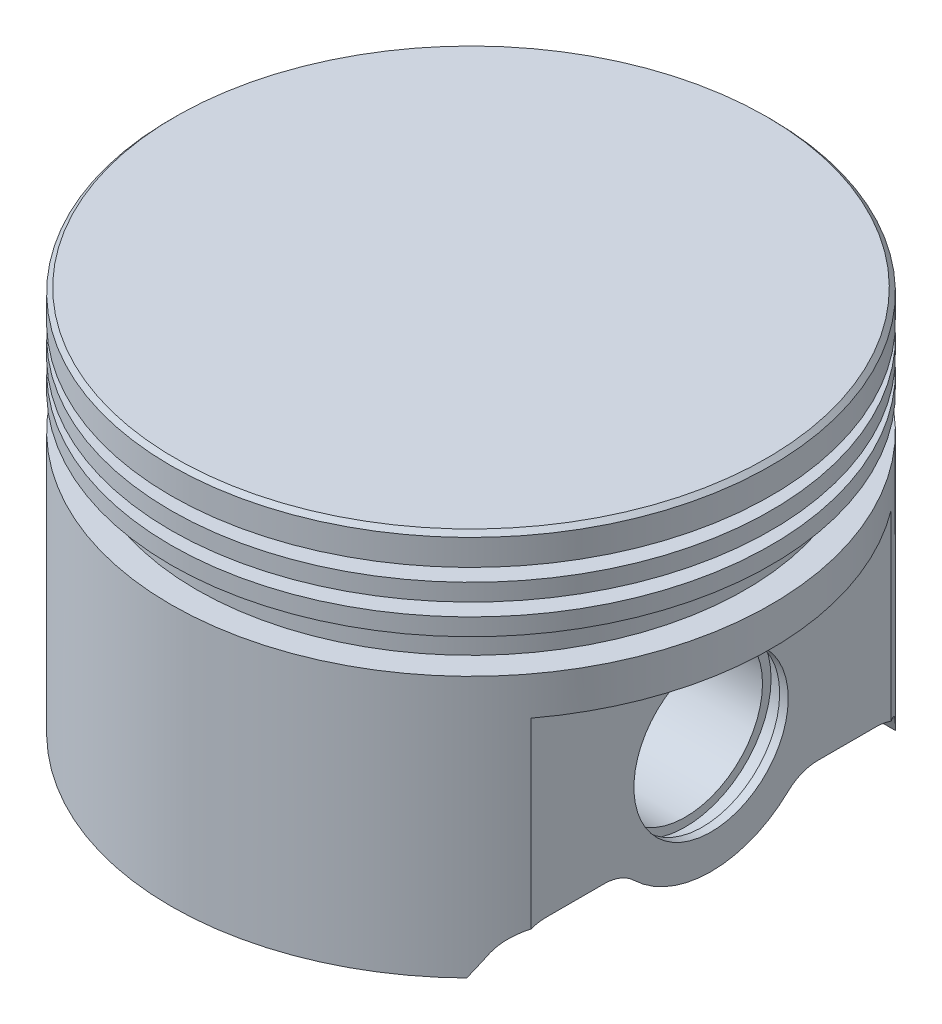
from build123d import *

# Parameters (mm, degrees)
BOSS_EXTRUDE1_REACH     = 68.895
CUT_EXTRUDE1_DEPTH      = 67.895440801
CUT_EXTRUDE1_DEPTH_BACK = 26
SKETCH4_R               = 9
CUT_EXTRUDE5_DEPTH      = 85.964698552
CUT_EXTRUDE6_START      = -1
SKETCH5_R               = 10
CUT_EXTRUDE6_DEPTH      = 2


with BuildPart() as part:
    # Sketch1 → Revolve6 (revolve)
    with BuildSketch(Plane.XY):
        Polygon((0, 0), (34.5, 0), (35, -0.5), (35, -3.530079997), (32, -3.530079997), (32, -5.030079997), (35, -5.030079997), (35, -7.030079997), (32, -7.030079997), (32, -8.530079997), (35, -8.530079997), (35, -10.530079997), (32, -10.530079997), (32, -14.530079997), (35, -14.530079997), (35, -45), (32, -45), (32, -23.460781634), (25, -17), (25, -7), (0, -7), align=None)
    revolve(axis=Axis((0, -7, 0), (0, 1, 0)))

    # Sketch2 → Boss-Extrude1 (add, up to next)
    with BuildSketch(Plane.XZ.offset(45), mode=Mode.PRIVATE) as boss_extrude1_sk1:
        with BuildLine():
            Line((-25, 19.974984355), (-25, 12))
            Line((-25, 12), (-12, 12))
            ThreePointArc((-12, 12), (-9.878679656, 11.121320344), (-9, 9))
            Line((-9, 9), (-9, -9))
            ThreePointArc((-9, -9), (-9.878679656, -11.121320344), (-12, -12))
            Line((-12, -12), (-25, -12))
            Line((-25, -12), (-25, -19.974984355))
            ThreePointArc((-25, -19.974984355), (-32, 0), (-25, 19.974984355))
        make_face()
    boss_extrude1_tool1 = extrude(boss_extrude1_sk1.sketch, amount=-BOSS_EXTRUDE1_REACH, mode=Mode.PRIVATE) - part.part
    # Sketch2 → Boss-Extrude1 (add, up to next)
    with BuildSketch(Plane.XZ.offset(45), mode=Mode.PRIVATE) as boss_extrude1_sk2:
        with BuildLine():
            Line((25, 19.974984355), (25, 12))
            Line((25, 12), (12, 12))
            ThreePointArc((12, 12), (9.878679656, 11.121320344), (9, 9))
            Line((9, 9), (9, -9))
            ThreePointArc((9, -9), (9.878679656, -11.121320344), (12, -12))
            Line((12, -12), (25, -12))
            Line((25, -12), (25, -19.974984355))
            ThreePointArc((25, -19.974984355), (32, 0), (25, 19.974984355))
        make_face()
    boss_extrude1_tool2 = extrude(boss_extrude1_sk2.sketch, amount=-BOSS_EXTRUDE1_REACH, mode=Mode.PRIVATE) - part.part
    add(boss_extrude1_tool1.solids().sort_by_distance((-20.669877, -45, 0))[0])
    add(boss_extrude1_tool2.solids().sort_by_distance((20.669877, -45, 0))[0])

    # Sketch3 → Cut-Extrude1 (cut, two sides: drawn at the far end of the back side and taken through both)
    with BuildSketch(Plane.XZ.offset(45).offset(-CUT_EXTRUDE1_DEPTH_BACK)):
        with BuildLine():
            Line((-28, 21), (-28, -21))
            ThreePointArc((-28, -21), (-35, 0), (-28, 21))
        make_face()
        with BuildLine():
            Line((28, 21), (28, -21))
            ThreePointArc((28, -21), (35, 0), (28, 21))
        make_face()
    extrude(amount=CUT_EXTRUDE1_DEPTH + CUT_EXTRUDE1_DEPTH_BACK, mode=Mode.SUBTRACT)

    # Sketch4 → Cut-Extrude5 (cut, through all)
    with BuildSketch(Plane(origin=(28, 0, 0), x_dir=(0, 0, -1), z_dir=(1, 0, 0))):
        with Locations((0, -32)):
            Circle(SKETCH4_R)
        with BuildLine():
            ThreePointArc((8.991594154, -41.388888889), (4.844813951, -44.063489453), (0, -45))
            Line((0, -45), (25, -45))
            Line((25, -45), (23.672124938, -42.588355767))
            ThreePointArc((23.672124938, -42.588355767), (21.835968082, -40.69545466), (19.292173786, -40))
            Line((19.292173786, -40), (12.449899598, -40))
            ThreePointArc((12.449899598, -40), (10.586509617, -40.360196364), (8.991594154, -41.388888889))
        make_face()
        with BuildLine():
            Line((-25, -45), (0, -45))
            ThreePointArc((0, -45), (-4.844813951, -44.063489453), (-8.991594154, -41.388888889))
            ThreePointArc((-8.991594154, -41.388888889), (-10.586509617, -40.360196364), (-12.449899598, -40))
            Line((-12.449899598, -40), (-19.292173786, -40))
            ThreePointArc((-19.292173786, -40), (-21.835968082, -40.69545466), (-23.672124938, -42.588355767))
            Line((-23.672124938, -42.588355767), (-25, -45))
        make_face()
    extrude(amount=-CUT_EXTRUDE5_DEPTH, mode=Mode.SUBTRACT)

    # Sketch5 → Cut-Extrude6 (cut)
    with BuildSketch(Plane(origin=(28, 0, 0), x_dir=(0, 0, -1), z_dir=(1, 0, 0)).offset(CUT_EXTRUDE6_START)):
        with Locations((0, -32)):
            Circle(SKETCH5_R)
    cut_extrude6 = extrude(amount=-CUT_EXTRUDE6_DEPTH, mode=Mode.SUBTRACT)

    # Mirror1: Cut-Extrude6 across plane
    add(cut_extrude6.mirror(Plane(origin=(0, 0, 0), x_dir=(0, 0, 1), z_dir=(1, 0, 0))), mode=Mode.SUBTRACT)


solid = part.part
